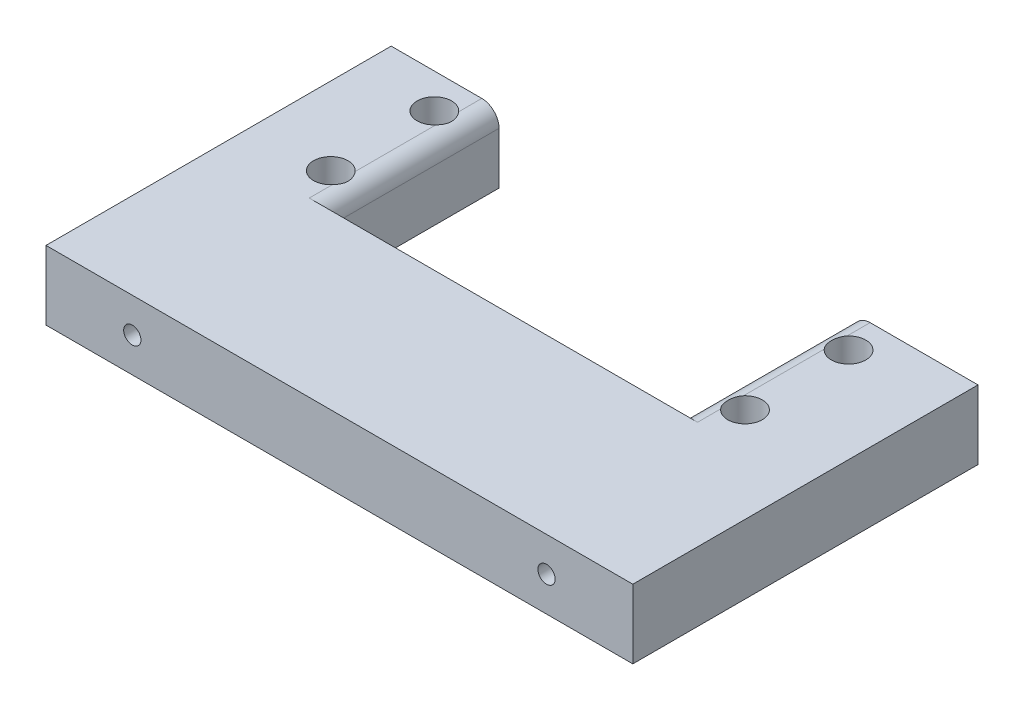
from build123d import *

# Parameters (mm, degrees)
SKETCH1_R           = 2
BOSS_EXTRUDE1_DEPTH = 8
CUT_EXTRUDE1_START  = 17.721034
SKETCH2_R           = 1
CUT_EXTRUDE1_DEPTH  = 8
FILLET1_R           = 2


with BuildPart() as part:
    # Sketch1 → Boss-Extrude1 (new body)
    with BuildSketch(Plane(origin=(0, 0, 0), x_dir=(1, 0, 0), z_dir=(0, 1, 0))):
        Polygon((19.047511312, 22.278966214), (33.547511312, 22.278966214), (33.547511312, -17.721033786), (-34.452488688, -17.721033786), (-34.452488688, 22.278966214), (-21.952488688, 22.278966214), (-21.952488688, 2.278966214), (19.047511312, 2.278966214), align=None)
        with Locations(Location((-25.452488688, 18.278966214, 0), (0, 0, 270))):
            Circle(SKETCH1_R, mode=Mode.SUBTRACT)
        with Locations(Location((-25.452488688, 6.278966214, 0), (0, 0, 270))):
            Circle(SKETCH1_R, mode=Mode.SUBTRACT)
        with Locations(Location((22.547511312, 18.278966214, 0), (0, 0, 270))):
            Circle(SKETCH1_R, mode=Mode.SUBTRACT)
        with Locations(Location((22.547511312, 6.278966214, 0), (0, 0, 270))):
            Circle(SKETCH1_R, mode=Mode.SUBTRACT)
    extrude(amount=BOSS_EXTRUDE1_DEPTH)

    # Sketch2 → Cut-Extrude1 (cut)
    with BuildSketch(Plane.XY.offset(CUT_EXTRUDE1_START)):
        with Locations(Location((-24.452488688, 4, 0), (0, 0, 180))):
            Circle(SKETCH2_R)
        with Locations(Location((23.547511312, 4, 0), (0, 0, 180))):
            Circle(SKETCH2_R)
    extrude(amount=-CUT_EXTRUDE1_DEPTH, mode=Mode.SUBTRACT)

    # Fillet1
    # the kernel refuses this fillet: 2 mm, written as the material it takes off along each edge
    with BuildSketch(Plane(origin=(19.047511312, 8, -2.278966214), x_dir=(0, -1, 0), z_dir=(0, 0, -1))) as fillet1_piece_1:
        with BuildLine():
            CenterArc((FILLET1_R, -FILLET1_R), FILLET1_R, 90, 90)
            Line((0, -FILLET1_R), (0, 0))
            Line((0, 0), (FILLET1_R, 0))
        make_face()
    extrude(amount=25, mode=Mode.SUBTRACT)
    with BuildSketch(Plane(origin=(-21.952488688, 8, -27.278966214), x_dir=(-1, 0, 0), z_dir=(0, 0, 1))) as fillet1_piece_2:
        with BuildLine():
            CenterArc((FILLET1_R, FILLET1_R), FILLET1_R, 180, 90)
            Line((0, FILLET1_R), (0, 0))
            Line((0, 0), (FILLET1_R, 0))
        make_face()
    extrude(amount=25, mode=Mode.SUBTRACT)


solid = part.part
